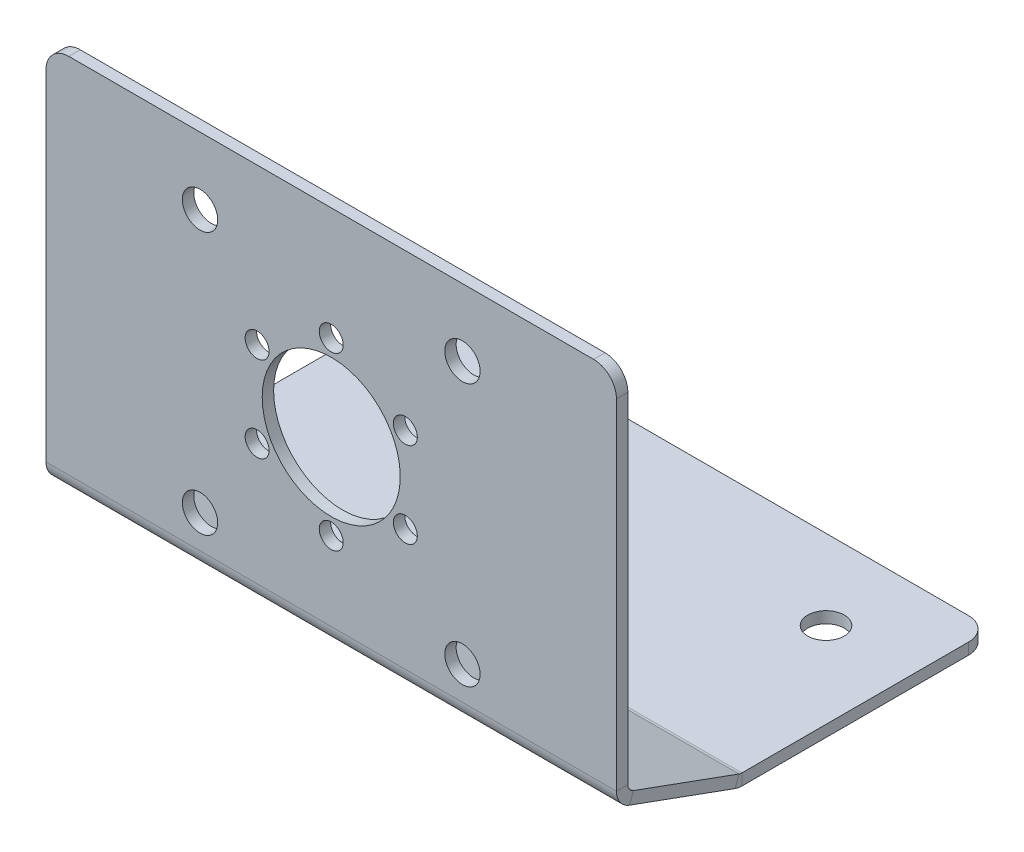
from build123d import *

# Parameters (mm, degrees)
SKETCH_1_W                       = 50
SKETCH_1_H                       = 22
SKETCH_1_R                       = 1.6
SM_BASE_FLANGE_1_DEPTH           = 1
SM_EDGE_FLANGE_5_STRIP_CUT_DEPTH = 50
SM_EDGE_FLANGE_5_DEPTH           = 50
SM_EDGE_FLANGE_4_STRIP_CUT_DEPTH = 50
SM_EDGE_FLANGE_4_DEPTH           = 50
SKETCH_9_R                       = 1.55
SKETCH_9_R_2                     = 1.05
SKETCH_9_R_3                     = 6.05
SKETCH_9_R_4                     = 4.1
CUT_EXTRUDE_1_DEPTH              = 10
FILLET_1_R                       = 2


# Sheet-metal steps are written as plain solids
with BuildPart() as part:
    # Sketch 1 → 基体-法兰1 (new body)
    with BuildSketch(Plane(origin=(0, 0, 0), x_dir=(1, 0, 0), z_dir=(0, 1, 0))):
        Rectangle(SKETCH_1_W, SKETCH_1_H)
        with Locations(Location((0, -7.5, 0), (0, 0, 270))):
            Circle(SKETCH_1_R, mode=Mode.SUBTRACT)
        with Locations(Location((-17.5, 4, 0), (0, 0, 270))):
            Circle(SKETCH_1_R, mode=Mode.SUBTRACT)
        with Locations(Location((17.5, 4, 0), (0, 0, 90))):
            Circle(SKETCH_1_R, mode=Mode.SUBTRACT)
    extrude(amount=-SM_BASE_FLANGE_1_DEPTH)

    # 边线-法兰5 strip (across the edge) → 边线-法兰5 strip cut (cut)
    with BuildSketch(Plane(origin=(-25, 0, 11), x_dir=(0, 0.9396926207859105, -0.3420201433256631), z_dir=(1, 0, 0))):
        Polygon((-2.767214854, 4.679055925), (-0.895270205, -0.464069727), (0.044422416, -0.122049584), (-1.827522233, 5.021076069), align=None)
    extrude(amount=SM_EDGE_FLANGE_5_STRIP_CUT_DEPTH, mode=Mode.SUBTRACT)

    # 边线-法兰5 section (across the edge) → 边线-法兰5 (add)
    with BuildSketch(Plane(origin=(-25, 0, 11), x_dir=(0, 0.9396926207859105, -0.3420201433256631), z_dir=(1, 0, 0))):
        with BuildLine():
            Line((-1, 0.129882454), (-1, 10.5))
            Line((-1, 10.5), (0, 10.5))
            Line((0, 10.5), (0, 0.129882454))
            ThreePointArc((0, 0.129882454), (0.011190609, 0.001973206), (0.044422416, -0.122049584))
            Line((0.044422416, -0.122049584), (-0.895270205, -0.464069727))
            ThreePointArc((-0.895270205, -0.464069727), (-0.973617144, -0.171674971), (-1, 0.129882454))
        make_face()
    extrude(amount=SM_EDGE_FLANGE_5_DEPTH)

    # 边线-法兰4 strip (across the edge) → 边线-法兰4 strip cut (cut)
    with BuildSketch(Plane(origin=(-25, 3.591211505, 20.866772518), x_dir=(0, 0, -1), z_dir=(1, 0, 0))):
        Polygon((-5.000477833, 0.755847316), (0.142647819, -1.116097333), (0.484667962, -0.176404712), (-4.65845769, 1.695539937), align=None)
    extrude(amount=SM_EDGE_FLANGE_4_STRIP_CUT_DEPTH, mode=Mode.SUBTRACT)

    # 边线-法兰4 section (across the edge) → 边线-法兰4 (add)
    with BuildSketch(Plane(origin=(-25, 3.591211505, 20.866772518), x_dir=(0, 0, -1), z_dir=(1, 0, 0))):
        with BuildLine():
            Line((-1, 0.515772873), (-1, 32.299792462))
            Line((-1, 32.299792462), (0, 32.299792462))
            Line((0, 32.299792462), (0, 0.515772873))
            ThreePointArc((0, 0.515772873), (0.133212604, 0.09327647), (0.484667962, -0.176404712))
            Line((0.484667962, -0.176404712), (0.142647819, -1.116097333))
            ThreePointArc((0.142647819, -1.116097333), (-0.68593944, -0.480299967), (-1, 0.515772873))
        make_face()
    extrude(amount=SM_EDGE_FLANGE_4_DEPTH)

    # 草图9 → 切除-拉伸1 (cut)
    # profile 1 of 12: a face of its own
    with BuildSketch(Plane(origin=(0, 0, 20.866772518), x_dir=(-1, 0, 0), z_dir=(0, 0, -1))):
        with Locations((-11.5, 30)):
            Circle(SKETCH_9_R)
    # profile 2 of 12: a face of its own
    with BuildSketch(Plane(origin=(0, 0, 20.866772518), x_dir=(-1, 0, 0), z_dir=(0, 0, -1))):
        with Locations((11.5, 30)):
            Circle(SKETCH_9_R)
    # profile 3 of 12: a face of its own
    with BuildSketch(Plane(origin=(0, 0, 20.866772518), x_dir=(-1, 0, 0), z_dir=(0, 0, -1))):
        with Locations((6.495190528, 22.25)):
            Circle(SKETCH_9_R_2)
    # profile 4 of 12: a face of its own
    with BuildSketch(Plane(origin=(0, 0, 20.866772518), x_dir=(-1, 0, 0), z_dir=(0, 0, -1))):
        with Locations((0, 26)):
            Circle(SKETCH_9_R_2)
    # profile 5 of 12: a face of its own
    with BuildSketch(Plane(origin=(0, 0, 20.866772518), x_dir=(-1, 0, 0), z_dir=(0, 0, -1))):
        with Locations((-6.495190528, 22.25)):
            Circle(SKETCH_9_R_2)
    # profile 6 of 12: a face of its own
    with BuildSketch(Plane(origin=(0, 0, 20.866772518), x_dir=(-1, 0, 0), z_dir=(0, 0, -1))):
        with Locations((-6.495190528, 14.75)):
            Circle(SKETCH_9_R_2)
    # profile 7 of 12: a face of its own
    with BuildSketch(Plane(origin=(0, 0, 20.866772518), x_dir=(-1, 0, 0), z_dir=(0, 0, -1))):
        with Locations((0, 11)):
            Circle(SKETCH_9_R_2)
    # profile 8 of 12: a face of its own
    with BuildSketch(Plane(origin=(0, 0, 20.866772518), x_dir=(-1, 0, 0), z_dir=(0, 0, -1))):
        with Locations((6.495190528, 14.75)):
            Circle(SKETCH_9_R_2)
    # profile 9 of 12: a face of its own
    with BuildSketch(Plane(origin=(0, 0, 20.866772518), x_dir=(-1, 0, 0), z_dir=(0, 0, -1))):
        with Locations((0, 18.5)):
            Circle(SKETCH_9_R_3)
        with Locations((0, 18.5)):
            Circle(SKETCH_9_R_4, mode=Mode.SUBTRACT)
    # profile 10 of 12: a face of its own
    with BuildSketch(Plane(origin=(0, 0, 20.866772518), x_dir=(-1, 0, 0), z_dir=(0, 0, -1))):
        with Locations((0, 18.5)):
            Circle(SKETCH_9_R_4)
    # profile 11 of 12: a face of its own
    with BuildSketch(Plane(origin=(0, 0, 20.866772518), x_dir=(-1, 0, 0), z_dir=(0, 0, -1))):
        with Locations((11.5, 7)):
            Circle(SKETCH_9_R)
    # profile 12 of 12: a face of its own
    with BuildSketch(Plane(origin=(0, 0, 20.866772518), x_dir=(-1, 0, 0), z_dir=(0, 0, -1))):
        with Locations((-11.5, 7)):
            Circle(SKETCH_9_R)
    extrude(amount=-CUT_EXTRUDE_1_DEPTH, mode=Mode.SUBTRACT)

    # 圆角1
    fillet_1_edges = [part.edges().sort_by_distance(p)[0] for p in [
        (-25, 35.891003967, 21.366772518),
        (-25, -0.5, -11),
        (25, -0.5, -11),
        (25, 35.891003967, 21.366772518),
    ]]
    fillet(fillet_1_edges, radius=FILLET_1_R)


solid = part.part
